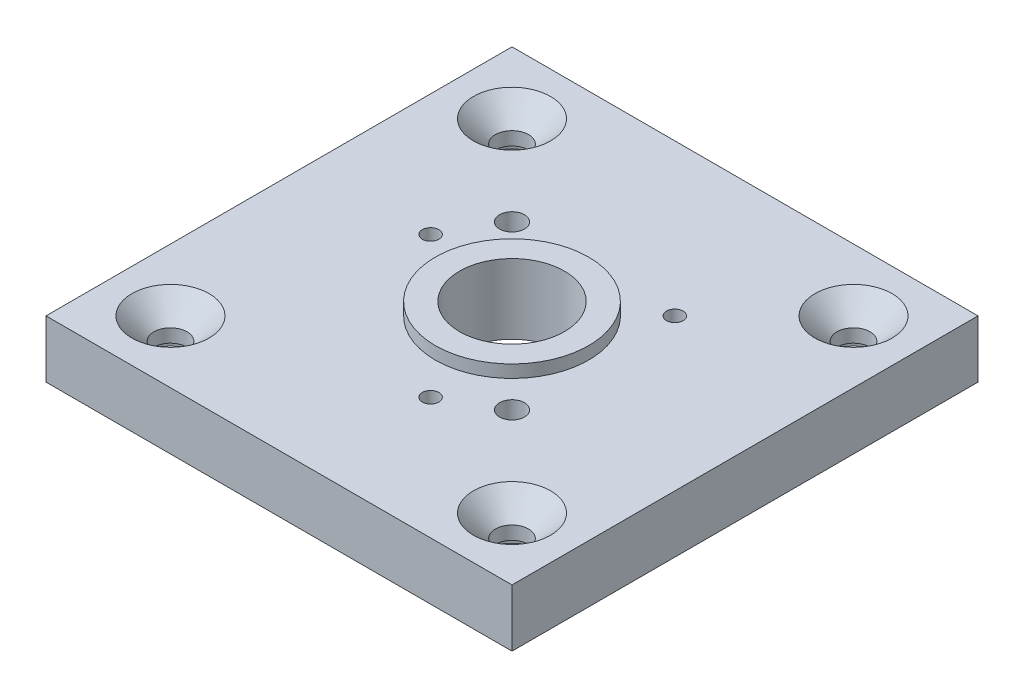
from build123d import *

# Parameters (mm, degrees)
SKETCH1_W           = 42.3
SKETCH1_H           = 42.3
SKETCH1_R           = 1.5
SKETCH1_R_2         = 4.7625
BOSS_EXTRUDE1_DEPTH = 5.21
SKETCH2_R           = 0.75565
SKETCH2_R_2         = 1.1303
CUT_EXTRUDE1_DEPTH  = 61.047681887
CHAMFER1_SIZE       = 2
SKETCH4_R           = 6.96
SKETCH4_R_2         = 4.7625
BOSS_EXTRUDE2_DEPTH = 1.14
SKETCH5_R           = 4
SKETCH5_R_2         = 1.5
CUT_EXTRUDE2_DEPTH  = 2


with BuildPart() as part:
    # Sketch1 → Boss-Extrude1 (new body)
    with BuildSketch(Plane(origin=(0, 0, 0), x_dir=(1, 0, 0), z_dir=(0, 1, 0))):
        with Locations((21.15, 21.15)):
            Rectangle(SKETCH1_W, SKETCH1_H)
        with Locations((36.65, 36.65)):
            Circle(SKETCH1_R, mode=Mode.SUBTRACT)
        with Locations((5.65, 5.65)):
            Circle(SKETCH1_R, mode=Mode.SUBTRACT)
        with Locations((36.65, 5.65)):
            Circle(SKETCH1_R, mode=Mode.SUBTRACT)
        with Locations((5.65, 36.65)):
            Circle(SKETCH1_R, mode=Mode.SUBTRACT)
        with Locations((21.15, 21.15)):
            Circle(SKETCH1_R_2, mode=Mode.SUBTRACT)
    extrude(amount=BOSS_EXTRUDE1_DEPTH)

    # Sketch2 → Cut-Extrude1 (cut, through all)
    with BuildSketch(Plane(origin=(0, 5.21, 0), x_dir=(1, 0, 0), z_dir=(0, 1, 0))):
        with Locations((11.056075115, 23.854659021)):
            Circle(SKETCH2_R)
        with Locations((28.539265863, 28.539265863)):
            Circle(SKETCH2_R)
        with Locations((23.854659021, 11.056075115)):
            Circle(SKETCH2_R)
        with Locations((28.539265863, 13.760734137)):
            Circle(SKETCH2_R_2)
        with Locations((13.760734137, 28.539265863)):
            Circle(SKETCH2_R_2)
    extrude(amount=-CUT_EXTRUDE1_DEPTH, mode=Mode.SUBTRACT)

    # Chamfer1
    chamfer1_edges = [part.edges().sort_by_distance(p)[0] for p in [
        (4.15, 5.21, -5.65),
        (35.15, 5.21, -5.65),
        (35.15, 5.21, -36.65),
        (4.15, 5.21, -36.65),
    ]]
    chamfer(chamfer1_edges, length=CHAMFER1_SIZE)

    # Sketch4 → Boss-Extrude2 (add)
    with BuildSketch(Plane(origin=(0, 5.21, 0), x_dir=(1, 0, 0), z_dir=(0, 1, 0))):
        with Locations((21.15, 21.15)):
            Circle(SKETCH4_R)
        with Locations((21.15, 21.15)):
            Circle(SKETCH4_R_2, mode=Mode.SUBTRACT)
    extrude(amount=BOSS_EXTRUDE2_DEPTH)

    # Sketch5 → Cut-Extrude2 (cut)
    # profile 1 of 4: a face of its own
    with BuildSketch(Plane.XZ):
        with Locations((36.65, -36.65)):
            Circle(SKETCH5_R)
        with Locations((36.65, -36.65)):
            Circle(SKETCH5_R_2, mode=Mode.SUBTRACT)
    # profile 2 of 4: a face of its own
    with BuildSketch(Plane.XZ):
        with Locations((5.65, -36.65)):
            Circle(SKETCH5_R)
        with Locations((5.65, -36.65)):
            Circle(SKETCH5_R_2, mode=Mode.SUBTRACT)
    # profile 3 of 4: a face of its own
    with BuildSketch(Plane.XZ):
        with Locations((5.65, -5.65)):
            Circle(SKETCH5_R)
        with Locations((5.65, -5.65)):
            Circle(SKETCH5_R_2, mode=Mode.SUBTRACT)
    # profile 4 of 4: a face of its own
    with BuildSketch(Plane.XZ):
        with Locations((36.65, -5.65)):
            Circle(SKETCH5_R)
        with Locations((36.65, -5.65)):
            Circle(SKETCH5_R_2, mode=Mode.SUBTRACT)
    extrude(amount=-CUT_EXTRUDE2_DEPTH, mode=Mode.SUBTRACT)


solid = part.part
